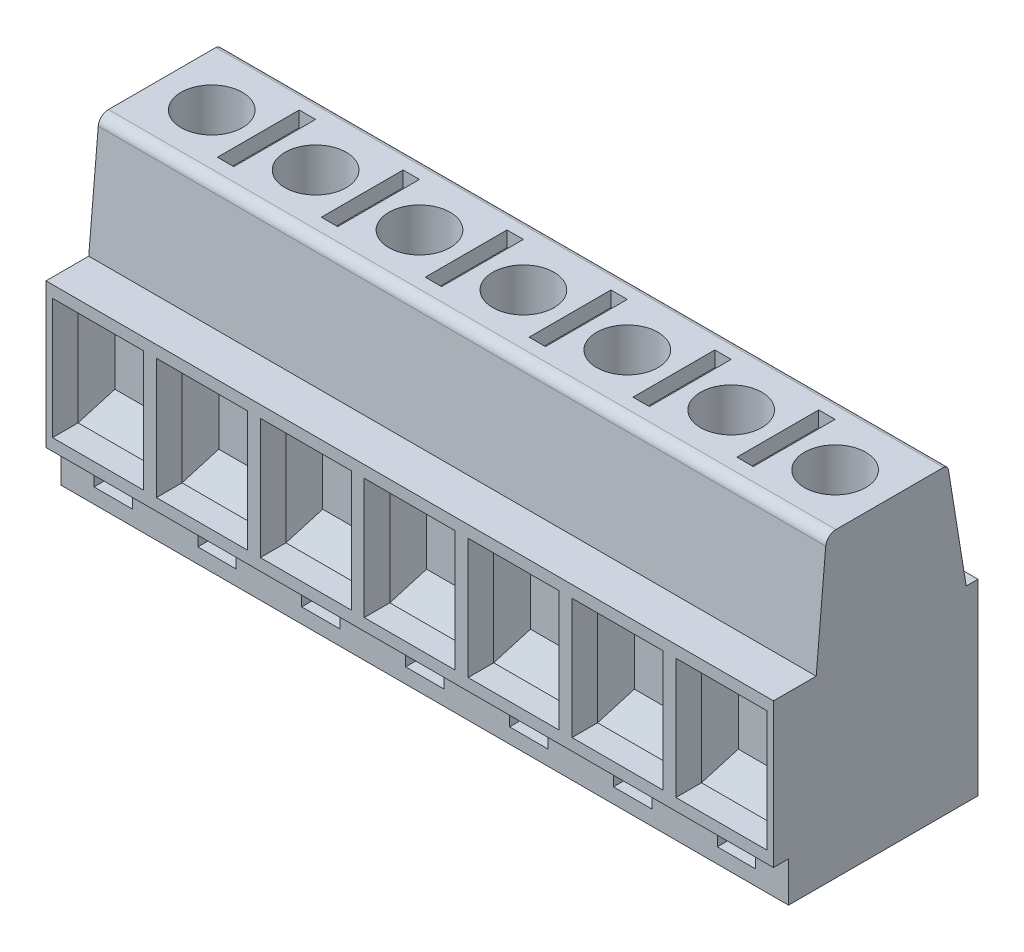
from build123d import *

# Parameters (mm, degrees)
BOSS_EXTRUDE1_DEPTH     = 10.16
SKETCH2_W               = 8.900000000000002
SKETCH2_H               = 11.800000000000011
CUT_EXTRUDE1_DEPTH      = 2.5
SKETCH5_R               = 2.9999999999999996
CUT_EXTRUDE2_DEPTH      = 5.7
SKETCH7_W               = 1.2999999999999998
SKETCH7_H               = 0.8000000000000007
SKETCH7_H_2             = 0.7999999999999936
BOSS_EXTRUDE2_DEPTH     = 4.5
CUT_EXTRUDE5_START      = -10.96
CUT_EXTRUDE5_DEPTH      = 10.96
SKETCH10_R              = 1.4999999999999998
CUT_EXTRUDE6_DEPTH      = 4.5
SKETCH13_W              = 3.75
SKETCH13_H              = 1
CUT_EXTRUDE8_DEPTH      = 3
FILLET3_R               = 0.5
FILLET4_R               = 1
SKETCH12_W              = 1.2999999999999998
SKETCH12_H              = 1.299999999999999
BOSS_EXTRUDE3_DEPTH     = 0.5
BOSS_EXTRUDE3_2_DEPTH   = 0.5
BOSS_EXTRUDE3_3_DEPTH   = 0.5
BOSS_EXTRUDE4_START     = 0.01
BOSS_EXTRUDE4_DEPTH     = 0.01
LPATTERN8_COUNT         = 7
LPATTERN8_PITCH         = 10.16
LPATTERN8_2_COUNT       = 7
LPATTERN8_2_PITCH       = 10.16
LPATTERN8_3_COUNT       = 7
LPATTERN8_3_PITCH       = 10.16
LPATTERN8_4_COUNT       = 7
LPATTERN8_4_PITCH       = 10.16
FILLET3_OF_LPATTERN8_R  = 0.5
FILLET4_OF_LPATTERN8_R  = 1
SKETCH11_W              = 1.6
SKETCH11_H              = 8
CUT_EXTRUDE7_DEPTH      = 1.5
LPATTERN9_START         = 57.041856165
LPATTERN9_OUTLINE_W     = 1.5999999999999943
LPATTERN9_OUTLINE_H     = 8
LPATTERN9_OUTLINE_W_2   = 1.5999999999999979
LPATTERN9_OUTLINE_W_3   = 1.6000000000000014
LPATTERN9_DEPTH         = 1.5
LPATTERN9_START_2       = 28.541856165
LPATTERN9_2_OUTLINE_W   = 1.2999999999999972
LPATTERN9_2_OUTLINE_H   = 1.299999999999999
LPATTERN9_2_OUTLINE_W_2 = 1.3000000000000007
LPATTERN9_2_OUTLINE_H_2 = 1.2999999999999972
LPATTERN9_2_OUTLINE_H_3 = 1.3000000000000007
LPATTERN9_2_DEPTH       = 0.5
BOSS_EXTRUDE6_DEPTH     = 0.01


# Read off the part's stored shape, not the designer's step: Cut-Extrude5, LPattern9
with BuildPart() as part:
    # Sketch1 → Boss-Extrude1 (new body)
    with BuildSketch(Plane(origin=(0, 0, 0), x_dir=(0, 0, -1), z_dir=(1, 0, 0))):
        Polygon((9.669213470381848, 32.96915259715871), (9.669213470381848, 47.08678337249189), (13.847501539912686, 47.08678337249189), (14.859335014289963, 58.54185616450892), (26.70903057031256, 58.54185616450892), (28.514863984729242, 47.38649061080074), (29.669213470381848, 47.38649061080074), (29.66921347038185, 29.041856164508925), (11.142277404209432, 29.04185616450892), (11.142277404209432, 32.96915259715871), align=None)
    boss_extrude1 = extrude(amount=BOSS_EXTRUDE1_DEPTH)

    # Sketch2 → Cut-Extrude1 (cut)
    with BuildSketch(Plane.XY.offset(-9.669213470381848)):
        with Locations((5.08, 40.0279679848253)):
            Rectangle(SKETCH2_W, SKETCH2_H)
    cut_extrude1 = extrude(amount=-CUT_EXTRUDE1_DEPTH, mode=Mode.SUBTRACT)

    # Sketch3 → Cut-Loft1 section 0
    with BuildSketch(Plane.XY.offset(-12.169213470381848)):
        with BuildLine():
            Line((9.530000000000001, 34.1279679848253), (9.530000000000001, 45.92796798482531))
            Line((9.530000000000001, 45.92796798482531), (0.6299999999999994, 45.92796798482531))
            Line((0.6299999999999994, 45.92796798482531), (0.6299999999999994, 34.1279679848253))
            Line((0.6299999999999994, 34.1279679848253), (9.530000000000001, 34.1279679848253))
        make_face()
    # Sketch4 → Cut-Loft1 section 1
    with BuildSketch(Plane.XY.offset(-14.069213470381849)):
        with BuildLine():
            Line((2.3299999999999987, 36.877967984825304), (7.829999999999998, 36.877967984825304))
            Line((7.829999999999998, 36.877967984825304), (7.829999999999998, 43.1779679848253))
            Line((7.829999999999998, 43.1779679848253), (2.3299999999999987, 43.1779679848253))
            Line((2.3299999999999987, 43.1779679848253), (2.3299999999999987, 36.877967984825304))
        make_face()
    cut_loft1 = loft(mode=Mode.SUBTRACT)

    # Sketch5 → Cut-Extrude2 (cut)
    with BuildSketch(Plane(origin=(0, 58.54185616450892, 0), x_dir=(1, 0, 0), z_dir=(0, 1, 0))):
        with Locations(Location((5.08, 20.784182792301262, 0), (0, 0, 270))):
            Circle(SKETCH5_R)
    cut_extrude2 = extrude(amount=-CUT_EXTRUDE2_DEPTH, mode=Mode.SUBTRACT)

    # Sketch7 → Boss-Extrude2 (add)
    with BuildSketch(Plane.XZ.offset(-29.041856164508918)):
        with Locations((5.08, -27.169213470381862)):
            Rectangle(SKETCH7_W, SKETCH7_H)
        with Locations((5.08, -17.00921347038186)):
            Rectangle(SKETCH7_W, SKETCH7_H_2)
    boss_extrude2 = extrude(amount=BOSS_EXTRUDE2_DEPTH)

    # Cut-Extrude5 outline → Cut-Extrude5 (cut)
    with BuildSketch(Plane.XY.offset(-16.60921347038186).offset(CUT_EXTRUDE5_START)):
        with BuildLine():
            Line((5.73, 24.541856165), (5.73, 25.191856165))
            ThreePointArc((5.73, 25.191856165), (5.539619408, 24.732236757), (5.08, 24.541856165))
            Line((5.08, 24.541856165), (5.73, 24.541856165))
        make_face()
        with BuildLine():
            Line((4.43, 24.541856165), (5.08, 24.541856165))
            ThreePointArc((5.08, 24.541856165), (4.620380592, 24.732236757), (4.43, 25.191856165))
            Line((4.43, 25.191856165), (4.43, 24.541856165))
        make_face()
    cut_extrude5 = extrude(amount=CUT_EXTRUDE5_DEPTH, mode=Mode.SUBTRACT)

    # Sketch10 → Cut-Extrude6 (cut)
    with BuildSketch(Plane(origin=(0, 38.527852040591384, -38.527852040591256), x_dir=(-1, 0, 0), z_dir=(0, 0.7071067811865488, -0.7071067811865464))):
        with Locations(Location((-5.08, 12.528006810151506, 0), (0, 0, 90))):
            Circle(SKETCH10_R)
    cut_extrude6 = extrude(amount=-CUT_EXTRUDE6_DEPTH, mode=Mode.SUBTRACT)

    # Sketch13 → Cut-Extrude8 (cut)
    with BuildSketch(Plane.XY.offset(-11.142277404209432)):
        with Locations((5.080000000000007, 31.005504380833823)):
            Rectangle(SKETCH13_W, SKETCH13_H)
    cut_extrude8 = extrude(amount=-CUT_EXTRUDE8_DEPTH, mode=Mode.SUBTRACT)

    # Fillet3
    fillet3_edges = [part.edges().sort_by_distance(p)[0] for p in [
        (5.08, 58.54185616450892, -26.70903057031256),
    ]]
    fillet(fillet3_edges, radius=FILLET3_R)

    # Fillet4
    fillet4_edges = [part.edges().sort_by_distance(p)[0] for p in [
        (5.08, 58.54185616450892, -14.859335014289963),
    ]]
    fillet(fillet4_edges, radius=FILLET4_R)

    # Sketch14 → Boss-Extrude4 (add)
    with BuildSketch(Plane(origin=(10.16, 0, 0), x_dir=(0, 0, -1), z_dir=(1, 0, 0)).offset(BOSS_EXTRUDE4_START)):
        with BuildLine():
            Line((14.77877644669124, 57.629844179105966), (13.847501539912686, 47.08678337249189))
            Line((13.847501539912686, 47.08678337249189), (9.669213470381848, 47.08678337249189))
            Line((9.669213470381848, 47.08678337249189), (9.669213470381848, 32.96915259715871))
            Line((9.669213470381848, 32.96915259715871), (11.142277404209432, 32.96915259715871))
            Line((11.142277404209432, 32.96915259715871), (11.142277404209432, 29.04185616450892))
            Line((11.142277404209432, 29.04185616450892), (29.66921347038185, 29.041856164508925))
            Line((29.66921347038185, 29.041856164508925), (29.669213470381848, 47.38649061080074))
            Line((29.669213470381848, 47.38649061080074), (28.514863984729242, 47.38649061080074))
            Line((28.514863984729242, 47.38649061080074), (26.777036465378647, 58.121756163471794))
            ThreePointArc((26.777036465378647, 58.121756163471794), (26.607537368480997, 58.42261199143836), (26.28346175961899, 58.54185616450892))
            Line((26.28346175961899, 58.54185616450892), (15.77489798008326, 58.54185616450892))
            ThreePointArc((15.77489798008326, 58.54185616450892), (15.09961582223998, 58.279415658582806), (14.77877644669124, 57.629844179105966))
        make_face()
    extrude(amount=-BOSS_EXTRUDE4_DEPTH)



with BuildPart() as body_2:
    # Sketch12 → Boss-Extrude3 (new body)
    with BuildSketch(Plane.XZ.offset(-29.041856164508918)):
        with Locations((3.9e-16, -15.192277404209438)):
            Rectangle(SKETCH12_W, SKETCH12_H)
    extrude(amount=BOSS_EXTRUDE3_DEPTH)


with BuildPart() as body_3:
    # Sketch12 → Boss-Extrude3 2 (new body)
    with BuildSketch(Plane.XZ.offset(-29.041856164508918)):
        Polygon((-0.6500000000000012, -20.342277404209444), (0.6499999999999989, -20.342277404209444), (0.649999999999998, -19.04227740420944), (-0.6500000000000012, -19.04227740420944), align=None)
    extrude(amount=BOSS_EXTRUDE3_2_DEPTH)


with BuildPart() as body_4:
    # Sketch12 → Boss-Extrude3 3 (new body)
    with BuildSketch(Plane.XZ.offset(-29.041856164508918)):
        Polygon((-0.6499999999999996, -25.042277404209447), (0.6500000000000006, -25.042277404209447), (0.6500000000000008, -23.742277404209442), (-0.6499999999999996, -23.742277404209442), align=None)
    extrude(amount=BOSS_EXTRUDE3_3_DEPTH)


with BuildPart() as part_1:
    add(part.part)

    add(body_2.part)  # LPattern8 merges body 2

    add(body_3.part)  # LPattern8 merges body 3

    add(body_4.part)  # LPattern8 merges body 4
    # LPattern8: Boss-Extrude1 ×7
    with Locations(*[(-i * LPATTERN8_PITCH, 0, 0) for i in range(1, LPATTERN8_COUNT)]):
        add(boss_extrude1)

    # LPattern8 2: Cut-Extrude1, Cut-Loft1, Cut-Extrude2 ×7
    with Locations(*[(-i * LPATTERN8_2_PITCH, 0, 0) for i in range(1, LPATTERN8_2_COUNT)]):
        add(cut_extrude1, mode=Mode.SUBTRACT)
        add(cut_loft1, mode=Mode.SUBTRACT)
        add(cut_extrude2, mode=Mode.SUBTRACT)

    # LPattern8 3: Boss-Extrude2 ×7
    with Locations(*[(-i * LPATTERN8_3_PITCH, 0, 0) for i in range(1, LPATTERN8_3_COUNT)]):
        add(boss_extrude2)

    # LPattern8 4: Cut-Extrude5, Cut-Extrude6, Cut-Extrude8 ×7
    with Locations(*[(-i * LPATTERN8_4_PITCH, 0, 0) for i in range(1, LPATTERN8_4_COUNT)]):
        add(cut_extrude5, mode=Mode.SUBTRACT)
        add(cut_extrude6, mode=Mode.SUBTRACT)
        add(cut_extrude8, mode=Mode.SUBTRACT)

    # Fillet3 of LPattern8
    fillet3_of_lpattern8_edges = [part_1.edges().sort_by_distance(p)[0] for p in [
        (-5.08, 58.54185616450892, -26.70903057031256),
        (-15.24, 58.54185616450892, -26.70903057031256),
        (-25.4, 58.54185616450892, -26.70903057031256),
        (-35.56, 58.54185616450892, -26.70903057031256),
        (-45.72, 58.54185616450892, -26.70903057031256),
        (-55.88, 58.54185616450892, -26.70903057031256),
    ]]
    fillet(fillet3_of_lpattern8_edges, radius=FILLET3_OF_LPATTERN8_R)

    # Fillet4 of LPattern8
    fillet4_of_lpattern8_edges = [part_1.edges().sort_by_distance(p)[0] for p in [
        (-5.08, 58.54185616450892, -14.859335014289963),
        (-15.24, 58.54185616450892, -14.859335014289963),
        (-25.4, 58.54185616450892, -14.859335014289963),
        (-35.56, 58.54185616450892, -14.859335014289963),
        (-45.72, 58.54185616450892, -14.859335014289963),
        (-55.88, 58.54185616450892, -14.859335014289963),
    ]]
    fillet(fillet4_of_lpattern8_edges, radius=FILLET4_OF_LPATTERN8_R)

    # Sketch11 → Cut-Extrude7 (cut)
    with BuildSketch(Plane(origin=(0, 58.54185616450892, 0), x_dir=(1, 0, 0), z_dir=(0, 1, 0))):
        with Locations((4.16e-15, 21.064117563348077)):
            Rectangle(SKETCH11_W, SKETCH11_H)
    extrude(amount=-CUT_EXTRUDE7_DEPTH, mode=Mode.SUBTRACT)

    # LPattern9 outline → LPattern9 (cut)
    with BuildSketch(Plane(origin=(0, 0, 0), x_dir=(1, 0, 0), z_dir=(0, 1, 0)).offset(LPATTERN9_START)):
        with Locations((-50.800000000000004, 21.064117563)):
            Rectangle(LPATTERN9_OUTLINE_W, LPATTERN9_OUTLINE_H)
        with Locations((-40.64, 21.064117563)):
            Rectangle(LPATTERN9_OUTLINE_W, LPATTERN9_OUTLINE_H)
        with Locations((-30.480000000000004, 21.064117563)):
            Rectangle(LPATTERN9_OUTLINE_W_2, LPATTERN9_OUTLINE_H)
        with Locations((-20.32, 21.064117563)):
            Rectangle(LPATTERN9_OUTLINE_W_3, LPATTERN9_OUTLINE_H)
        with Locations((-10.16, 21.064117563)):
            Rectangle(LPATTERN9_OUTLINE_W_3, LPATTERN9_OUTLINE_H)
    extrude(amount=LPATTERN9_DEPTH, mode=Mode.SUBTRACT)

    # LPattern9 2 outline → LPattern9 2 (add)
    with BuildSketch(Plane(origin=(0, 0, 0), x_dir=(1, 0, 0), z_dir=(0, 1, 0)).offset(LPATTERN9_START_2)):
        with Locations((-50.800000000000004, 15.192277404000002)):
            Rectangle(LPATTERN9_2_OUTLINE_W, LPATTERN9_2_OUTLINE_H)
        with Locations((-40.64, 15.192277404000002)):
            Rectangle(LPATTERN9_2_OUTLINE_W, LPATTERN9_2_OUTLINE_H)
        with Locations((-30.479999999999997, 15.192277404000002)):
            Rectangle(LPATTERN9_2_OUTLINE_W, LPATTERN9_2_OUTLINE_H)
        with Locations((-20.32, 15.192277404000002)):
            Rectangle(LPATTERN9_2_OUTLINE_W, LPATTERN9_2_OUTLINE_H)
        with Locations((-10.16, 15.192277404000002)):
            Rectangle(LPATTERN9_2_OUTLINE_W_2, LPATTERN9_2_OUTLINE_H)
        with Locations((-50.800000000000004, 24.392277404)):
            Rectangle(LPATTERN9_2_OUTLINE_W, LPATTERN9_2_OUTLINE_H_2)
        with Locations((-50.800000000000004, 19.692277404000002)):
            Rectangle(LPATTERN9_2_OUTLINE_W, LPATTERN9_2_OUTLINE_H_3)
        with Locations((-40.64, 24.392277404)):
            Rectangle(LPATTERN9_2_OUTLINE_W, LPATTERN9_2_OUTLINE_H_2)
        with Locations((-40.64, 19.692277404000002)):
            Rectangle(LPATTERN9_2_OUTLINE_W, LPATTERN9_2_OUTLINE_H_3)
        with Locations((-30.479999999999997, 24.392277404)):
            Rectangle(LPATTERN9_2_OUTLINE_W, LPATTERN9_2_OUTLINE_H_2)
        with Locations((-30.479999999999997, 19.692277404000002)):
            Rectangle(LPATTERN9_2_OUTLINE_W, LPATTERN9_2_OUTLINE_H_3)
        with Locations((-20.32, 24.392277404)):
            Rectangle(LPATTERN9_2_OUTLINE_W, LPATTERN9_2_OUTLINE_H_2)
        with Locations((-20.32, 19.692277404000002)):
            Rectangle(LPATTERN9_2_OUTLINE_W, LPATTERN9_2_OUTLINE_H_3)
        with Locations((-10.16, 24.392277404)):
            Rectangle(LPATTERN9_2_OUTLINE_W_2, LPATTERN9_2_OUTLINE_H_2)
        with Locations((-10.16, 19.692277404000002)):
            Rectangle(LPATTERN9_2_OUTLINE_W_2, LPATTERN9_2_OUTLINE_H_3)
    extrude(amount=LPATTERN9_2_DEPTH)

    # Sketch16 → Boss-Extrude6 (add)
    with BuildSketch(Plane.ZY.offset(60.96)):
        with BuildLine():
            Line((-13.847501539912686, 47.08678337249189), (-14.77877644669124, 57.629844179105966))
            ThreePointArc((-14.77877644669124, 57.629844179105966), (-15.09961582223998, 58.279415658582806), (-15.77489798008326, 58.54185616450892))
            Line((-15.77489798008326, 58.54185616450892), (-26.28346175961899, 58.54185616450892))
            ThreePointArc((-26.28346175961899, 58.54185616450892), (-26.607537368480997, 58.42261199143836), (-26.777036465378647, 58.121756163471794))
            Line((-26.777036465378647, 58.121756163471794), (-28.514863984729242, 47.38649061080074))
            Line((-28.514863984729242, 47.38649061080074), (-29.669213470381848, 47.38649061080074))
            Line((-29.669213470381848, 47.38649061080074), (-29.66921347038185, 29.041856164508925))
            Line((-29.66921347038185, 29.041856164508925), (-11.142277404209432, 29.04185616450892))
            Line((-11.142277404209432, 29.04185616450892), (-11.142277404209432, 32.96915259715871))
            Line((-11.142277404209432, 32.96915259715871), (-9.669213470381848, 32.96915259715871))
            Line((-9.669213470381848, 32.96915259715871), (-9.669213470381848, 47.08678337249189))
            Line((-9.669213470381848, 47.08678337249189), (-13.847501539912686, 47.08678337249189))
        make_face()
    extrude(amount=BOSS_EXTRUDE6_DEPTH)


solid = part_1.part
